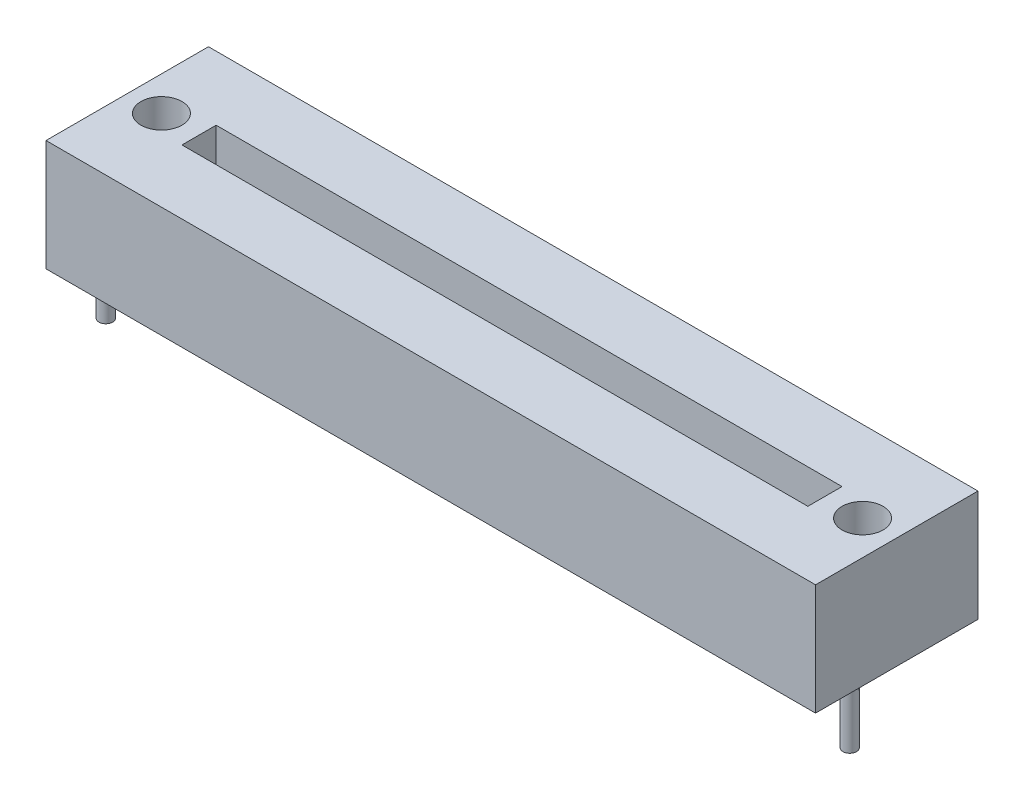
from build123d import *

# Parameters (mm, degrees)
SKETCH1_W            = 45
SKETCH1_H            = 9.5
SKETCH1_W_2          = 36.6
SKETCH1_H_2          = 2
BOSS_EXTRUDE1_DEPTH  = 6.5
SKETCH2_W            = 45
SKETCH2_H            = 9.5
BOSS_EXTRUDE2_DEPTH  = 2
M2_CLEARANCE_HOLE1_D = 2.4
SKETCH5_R            = 0.4
BOSS_EXTRUDE3_DEPTH  = 3.5


with BuildPart() as part:
    # Sketch1 → Boss-Extrude1 (new body)
    with BuildSketch(Plane(origin=(0, 0, 0), x_dir=(1, 0, 0), z_dir=(0, 1, 0))):
        Rectangle(SKETCH1_W, SKETCH1_H)
        Rectangle(SKETCH1_W_2, SKETCH1_H_2, mode=Mode.SUBTRACT)
    extrude(amount=BOSS_EXTRUDE1_DEPTH)

    # Sketch2 → Boss-Extrude2 (add)
    with BuildSketch(Plane.XZ):
        Rectangle(SKETCH2_W, SKETCH2_H)
    extrude(amount=-BOSS_EXTRUDE2_DEPTH)

    # M2 Clearance Hole1 (through all)
    with Locations(Plane(origin=(0, 6.5, 0), x_dir=(1, 0, 0), z_dir=(0, 1, 0))):
        with Locations((20.5, 0), (-20.5, 0)):
            Hole(M2_CLEARANCE_HOLE1_D / 2)

    # Sketch5 → Boss-Extrude3 (add)
    with BuildSketch(Plane.XZ):
        with Locations((-21.75, 2)):
            Circle(SKETCH5_R)
        with Locations((-21.75, -2)):
            Circle(SKETCH5_R)
        with Locations((21.75, 2)):
            Circle(SKETCH5_R)
    extrude(amount=BOSS_EXTRUDE3_DEPTH)


solid = part.part
